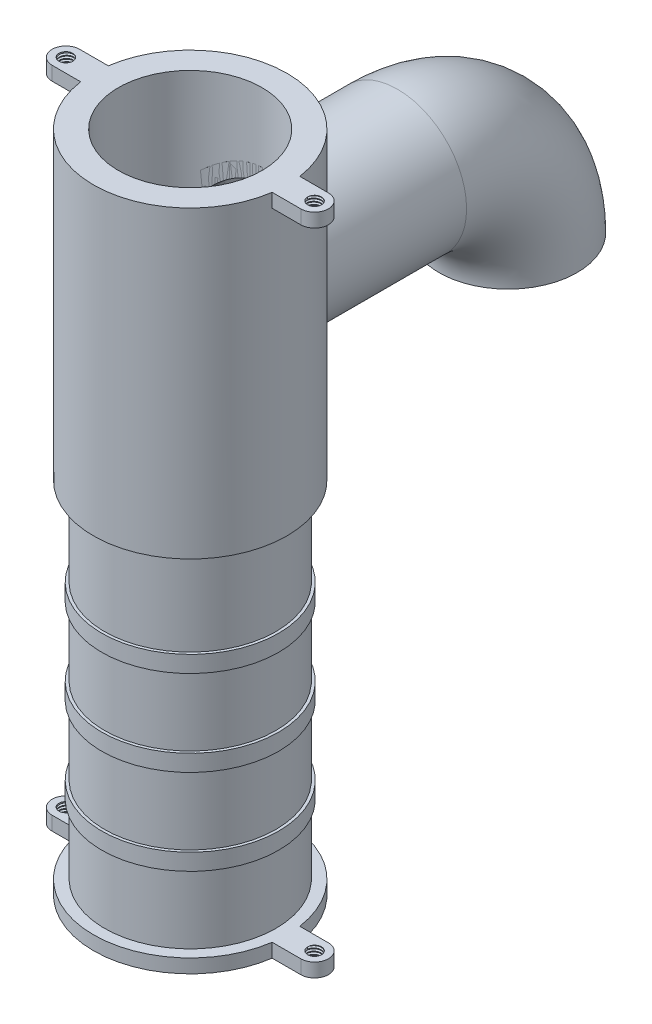
from build123d import *
from build123d.topology import SkipClean

# Parameters (mm, degrees)
BOSS_EXTRUDE1_DEPTH         = 6.35
F_1_4_0_25_DIAMETER_HOLE1_D = 6.35
THREAD1_PITCH               = 1.27
SKETCH13_W                  = 44.45
SKETCH13_H                  = 6.35
CUT_EXTRUDE1_REACH          = 327.836
CUT_EXTRUDE1_END_RADIUS     = 33.02
SKETCH14_R                  = 25.4
CUT_EXTRUDE2_START          = -298.45
SKETCH15_R                  = 33.02
CUT_EXTRUDE2_DEPTH          = 298.45
SKETCH16_R                  = 1.27
BOSS_EXTRUDE4_DEPTH         = 3.175
SWEEP1_PROFILE_R            = 31.75
SHELL1_START                = -95.2500001
SHELL1_OUTLINE_R            = 25.4
SHELL1_DEPTH                = 19.0500001
SHELL1_2_OUTLINE_R          = 25.4
SHELL1_2_ANGLE              = 90
BOSS_EXTRUDE5_START         = -6.35
SKETCH26_R                  = 3.175
BOSS_EXTRUDE5_DEPTH         = 6.35
THREAD2_PITCH               = 1.27


with BuildPart() as part:
    # Sketch1 → Revolve1 (revolve)
    with BuildSketch(Plane.XY, mode=Mode.PRIVATE) as revolve1_sk:
        Polygon((-25.4, 0), (-25.4, -6.35), (-44.45, -6.35), (-44.45, 0), (-39.37, 0), (-39.37, 31.75), (-40.64, 31.75), (-40.64, 39.37), (-39.37, 39.37), (-39.37, 71.12), (-40.64, 71.12), (-40.64, 78.74), (-39.37, 78.74), (-39.37, 110.49), (-40.64, 110.49), (-40.64, 118.11), (-39.37, 118.11), (-39.37, 158.75), (-44.45, 158.75), (-44.45, 298.45), (-33.02, 298.45), (-33.02, 0), align=None)
    revolve(revolve1_sk.sketch.rotate(Axis((0, -1265.377108682, 0), (0, 1, 0)), 180), axis=Axis((0, -1265.377108682, 0), (0, 1, 0)))

    # Sketch2 → Boss-Extrude1 (add)
    with BuildSketch(Plane(origin=(0, 0, 0), x_dir=(1, 0, 0), z_dir=(0, 1, 0))):
        with BuildLine():
            Line((43.18, 0), (43.18, 6.35))
            Line((43.18, 6.35), (57.15, 6.35))
            ThreePointArc((57.15, 6.35), (63.5, 0), (57.15, -6.35))
            Line((57.15, -6.35), (43.18, -6.35))
            Line((43.18, -6.35), (43.18, 0))
        make_face()
    boss_extrude1 = extrude(amount=-BOSS_EXTRUDE1_DEPTH)

    # Mirror1: Boss-Extrude1 across plane
    add(boss_extrude1.mirror(Plane(origin=(0, 0, 0), x_dir=(0, 0, 1), z_dir=(1, 0, 0))))

    # 1/4 (0.25) Diameter Hole1 (through all)
    with Locations(Plane(origin=(0, 0, 0), x_dir=(1, 0, 0), z_dir=(0, 1, 0))):
        with Locations((57.15, 0), (-57.15, 0)):
            Hole(F_1_4_0_25_DIAMETER_HOLE1_D / 2)

    # Thread1: arcs per turn and ends read off the stored shape
    # Thread1: the profile of Thread Profile2 profile screwed along a right-hand helix through 7.874016 turns, 8 arcs to a turn; built about Z, then put on its axis
    thread1_z = Axis((0, 0, 0), (0, 0, 1))
    thread1_corners = [(3.1747, 0, -0.000173205), (3.862407661, 0, 0.396874998), (3.862407661, 0, 0.555624998), (3.1747, 0, 0.952673202)]
    with BuildLine(mode=Mode.PRIVATE) as thread1_profile:
        Line(thread1_corners[0], thread1_corners[1])
        Line(thread1_corners[1], thread1_corners[2])
        Line(thread1_corners[2], thread1_corners[3])
        Line(thread1_corners[3], thread1_corners[0])
    thread1_cap = Face(thread1_profile.wire())
    thread1_turn_angles = [0, 22.5, 45, 67.5, 90, 112.5, 135, 157.5, 180, 202.5, 225, 247.5, 270, 292.5, 315, 337.5, 360]
    thread1_turn_weights = [1, 0.9238795325112867, 1, 0.9238795325112867, 1, 0.9238795325112867, 1, 0.9238795325112867, 1, 0.9238795325112867, 1, 0.9238795325112867, 1, 0.9238795325112867, 1, 0.9238795325112867, 1]
    thread1_turn_rails = [Edge.make_bspline([Vector(p[0], p[1], 0).rotate(thread1_z, thread1_turn_angles[k]) / thread1_turn_weights[k] + Vector(0, 0, p[2] + THREAD1_PITCH * thread1_turn_angles[k] / 360) for k in range(17)], [0, 0, 0, 1, 1, 2, 2, 3, 3, 4, 4, 5, 5, 6, 6, 7, 7, 8, 8, 8], 2, thread1_turn_weights) for p in thread1_corners]
    thread1_turn_sides = [Face.make_surface_from_curves(thread1_turn_rails[p[0]], thread1_turn_rails[p[1]]) for p in [(0, 1), (1, 2), (2, 3), (3, 0)]]
    thread1_last_angles = [2520, 2542.5, 2565, 2587.5, 2610, 2632.5, 2655, 2677.5, 2700, 2722.5, 2745, 2767.5, 2790, 2812.322834646, 2834.645669291]
    thread1_last_weights = [1, 0.9238795325112867, 1, 0.9238795325112867, 1, 0.9238795325112867, 1, 0.9238795325112867, 1, 0.9238795325112867, 1, 0.9238795325112867, 1, 0.9250584165493104, 1]
    thread1_last_rails = [Edge.make_bspline([Vector(p[0], p[1], 0).rotate(thread1_z, thread1_last_angles[k]) / thread1_last_weights[k] + Vector(0, 0, p[2] + THREAD1_PITCH * thread1_last_angles[k] / 360) for k in range(15)], [0, 0, 0, 1, 1, 2, 2, 3, 3, 4, 4, 5, 5, 6, 6, 7, 7, 7], 2, thread1_last_weights) for p in thread1_corners]
    thread1_last_sides = [Face.make_surface_from_curves(thread1_last_rails[p[0]], thread1_last_rails[p[1]]) for p in [(0, 1), (1, 2), (2, 3), (3, 0)]]
    thread1 = Plane(origin=(57.15, 0, 0), x_dir=(-1, 0, 0), z_dir=(0, -1, 0)) * Solid(Shell([*[p.moved(Location((0, 0, THREAD1_PITCH * i))) for i in range(7) for p in thread1_turn_sides], *thread1_last_sides, thread1_cap, thread1_cap.rotate(thread1_z, 2834.645669291).moved(Location((0, 0, THREAD1_PITCH * 2834.645669291 / 360)))]))
    add(thread1, mode=Mode.SUBTRACT)

    # Mirror2: Thread1 across plane
    add(thread1.mirror(Plane(origin=(0, 0, 0), x_dir=(0, 0, 1), z_dir=(1, 0, 0))), mode=Mode.SUBTRACT)

    # Cut-Extrude1: up to this cylinder (the profile starts outside it)
    cut_extrude1_end = Plane(origin=(0, 234.95, 0), z_dir=(0, -1, 0)) * Cylinder(CUT_EXTRUDE1_END_RADIUS, 722.712, mode=Mode.PRIVATE)
    # Sketch14 → Cut-Extrude1 (cut, up to the surface)
    with BuildSketch(Plane(origin=(0, 0, -69.85), x_dir=(-1, 0, 0), z_dir=(0, 0, -1)), mode=Mode.PRIVATE) as cut_extrude1_sk1:
        with Locations(Location((0, 234.95, 0), (0, 0, 180))):
            Circle(SKETCH14_R)
    cut_extrude1_tool1 = extrude(cut_extrude1_sk1.sketch, amount=-CUT_EXTRUDE1_REACH, mode=Mode.PRIVATE) - cut_extrude1_end
    add(cut_extrude1_tool1.solids().sort_by_distance((0, 234.95, -69.85))[0], mode=Mode.SUBTRACT)

    # Sketch16 → Boss-Extrude4 (add, symmetric)
    with BuildSketch(Plane(origin=(0, 0, 0), x_dir=(0, 0, -1), z_dir=(1, 0, 0))):
        with BuildLine():
            Line((-31.75, 0), (-26.162, 0))
            Line((-26.162, 0), (-26.162, 3.048))
            ThreePointArc((-26.162, 3.048), (-28.956, 5.842), (-31.75, 3.048))
            Line((-31.75, 3.048), (-31.75, 0))
        make_face()
        with Locations((-28.956, 2.921)):
            Circle(SKETCH16_R, mode=Mode.SUBTRACT)
    extrude(amount=BOSS_EXTRUDE4_DEPTH, both=True)

    # Sketch26 → Boss-Extrude5 (add)
    with BuildSketch(Plane(origin=(0, 298.45, 0), x_dir=(1, 0, 0), z_dir=(0, 1, 0)).offset(BOSS_EXTRUDE5_START)):
        with BuildLine():
            Line((42.672, 0), (42.672, 6.35))
            Line((42.672, 6.35), (57.15, 6.35))
            ThreePointArc((57.15, 6.35), (63.5, 0), (57.15, -6.35))
            Line((57.15, -6.35), (42.672, -6.35))
            Line((42.672, -6.35), (42.672, 0))
        make_face()
        with Locations(Location((57.15, 0, 0), (0, 0, 180))):
            Circle(SKETCH26_R, mode=Mode.SUBTRACT)
    boss_extrude5 = extrude(amount=BOSS_EXTRUDE5_DEPTH)

    # Thread2: arcs per turn and ends read off the stored shape
    # Thread2: the profile of Thread Profile3 profile screwed along a right-hand helix through 7.874016 turns, 8 arcs to a turn; built about Z, then put on its axis
    thread2_z = Axis((0, 0, 0), (0, 0, 1))
    thread2_corners = [(3.1747, 0, -0.000173205), (3.862407661, 0, 0.396874998), (3.862407661, 0, 0.555624998), (3.1747, 0, 0.952673202)]
    with BuildLine(mode=Mode.PRIVATE) as thread2_profile:
        Line(thread2_corners[0], thread2_corners[1])
        Line(thread2_corners[1], thread2_corners[2])
        Line(thread2_corners[2], thread2_corners[3])
        Line(thread2_corners[3], thread2_corners[0])
    thread2_cap = Face(thread2_profile.wire())
    thread2_turn_angles = [0, 22.5, 45, 67.5, 90, 112.5, 135, 157.5, 180, 202.5, 225, 247.5, 270, 292.5, 315, 337.5, 360]
    thread2_turn_weights = [1, 0.9238795325112867, 1, 0.9238795325112867, 1, 0.9238795325112867, 1, 0.9238795325112867, 1, 0.9238795325112867, 1, 0.9238795325112867, 1, 0.9238795325112867, 1, 0.9238795325112867, 1]
    thread2_turn_rails = [Edge.make_bspline([Vector(p[0], p[1], 0).rotate(thread2_z, thread2_turn_angles[k]) / thread2_turn_weights[k] + Vector(0, 0, p[2] + THREAD2_PITCH * thread2_turn_angles[k] / 360) for k in range(17)], [0, 0, 0, 1, 1, 2, 2, 3, 3, 4, 4, 5, 5, 6, 6, 7, 7, 8, 8, 8], 2, thread2_turn_weights) for p in thread2_corners]
    thread2_turn_sides = [Face.make_surface_from_curves(thread2_turn_rails[p[0]], thread2_turn_rails[p[1]]) for p in [(0, 1), (1, 2), (2, 3), (3, 0)]]
    thread2_last_angles = [2520, 2542.5, 2565, 2587.5, 2610, 2632.5, 2655, 2677.5, 2700, 2722.5, 2745, 2767.5, 2790, 2812.322834646, 2834.645669291]
    thread2_last_weights = [1, 0.9238795325112867, 1, 0.9238795325112867, 1, 0.9238795325112867, 1, 0.9238795325112867, 1, 0.9238795325112867, 1, 0.9238795325112867, 1, 0.9250584165493104, 1]
    thread2_last_rails = [Edge.make_bspline([Vector(p[0], p[1], 0).rotate(thread2_z, thread2_last_angles[k]) / thread2_last_weights[k] + Vector(0, 0, p[2] + THREAD2_PITCH * thread2_last_angles[k] / 360) for k in range(15)], [0, 0, 0, 1, 1, 2, 2, 3, 3, 4, 4, 5, 5, 6, 6, 7, 7, 7], 2, thread2_last_weights) for p in thread2_corners]
    thread2_last_sides = [Face.make_surface_from_curves(thread2_last_rails[p[0]], thread2_last_rails[p[1]]) for p in [(0, 1), (1, 2), (2, 3), (3, 0)]]
    thread2 = Plane(origin=(57.15, 298.45, 0), x_dir=(-1, 0, 0), z_dir=(0, -1, 0)) * Solid(Shell([*[p.moved(Location((0, 0, THREAD2_PITCH * i))) for i in range(7) for p in thread2_turn_sides], *thread2_last_sides, thread2_cap, thread2_cap.rotate(thread2_z, 2834.645669291).moved(Location((0, 0, THREAD2_PITCH * 2834.645669291 / 360)))]))
    add(thread2, mode=Mode.SUBTRACT)

    # Mirror3: Boss-Extrude5, Thread2 across plane
    add(boss_extrude5.mirror(Plane(origin=(0, 0, 0), x_dir=(0, 0, 1), z_dir=(1, 0, 0))))
    add(thread2.mirror(Plane(origin=(0, 0, 0), x_dir=(0, 0, 1), z_dir=(1, 0, 0))), mode=Mode.SUBTRACT)


with BuildPart() as body_2:
    # Sketch13 → Revolve5 (revolve)
    with BuildSketch(Plane(origin=(0, 0, 0), x_dir=(0, 0, -1), z_dir=(1, 0, 0)), mode=Mode.PRIVATE) as revolve5_sk:
        with Locations((47.625, 263.525)):
            Rectangle(SKETCH13_W, SKETCH13_H)
    revolve(revolve5_sk.sketch.rotate(Axis((0, 234.95, 1000), (0, 0, -1)), 90), axis=Axis((0, 234.95, 1000), (0, 0, -1)))

    # Sketch15 → Cut-Extrude2 (cut)
    with BuildSketch(Plane(origin=(0, 298.45, 0), x_dir=(1, 0, 0), z_dir=(0, 1, 0)).offset(CUT_EXTRUDE2_START)):
        Circle(SKETCH15_R)
    extrude(amount=CUT_EXTRUDE2_DEPTH, mode=Mode.SUBTRACT)

    # Sweep1: sweep along a path in Sketch17
    with SkipClean():  # the faces are left unmerged after this step: merging them gives an invalid solid
        with BuildLine(Plane(origin=(0, 0, 0), x_dir=(0, 0, -1), z_dir=(1, 0, 0))) as sweep1_path:
            Line((69.85, 234.95), (95.25, 234.95))
            ThreePointArc((95.25, 234.95), (131.171024484, 220.071024484), (146.05, 184.15))
        # Sweep1 profile (on start of the path) → Sweep1 (sweep)
        with BuildSketch(Plane(origin=(0, 234.95, -69.85), x_dir=(-1, 0, 0), z_dir=(0, 0, -1))):
            Circle(SWEEP1_PROFILE_R)
        sweep(path=sweep1_path.line)

    # Shell1: read off the stored shape, not the designer's step
    # Shell1 outline → Shell1 (cut)
    with SkipClean():  # the faces are left unmerged after this step: merging them gives an invalid solid
        with BuildSketch(Plane.XY.offset(SHELL1_START)):
            with Locations((0, 234.95)):
                Circle(SHELL1_OUTLINE_R)
        extrude(amount=SHELL1_DEPTH, mode=Mode.SUBTRACT)

    # Shell1 2 outline → Shell1 2 (revolve, cut)
    with SkipClean():  # the faces are left unmerged after this step: merging them gives an invalid solid
        with BuildSketch(Plane(origin=(0, 184.15, -95.25), x_dir=(0, 0, -1), z_dir=(0, -1, 0))):
            with Locations((50.8, 0)):
                Circle(SHELL1_2_OUTLINE_R)
        revolve(axis=Axis((0, 184.15, -95.25), (1, 0, 0)), revolution_arc=SHELL1_2_ANGLE, mode=Mode.SUBTRACT)


solid = Compound([part.part, body_2.part])
